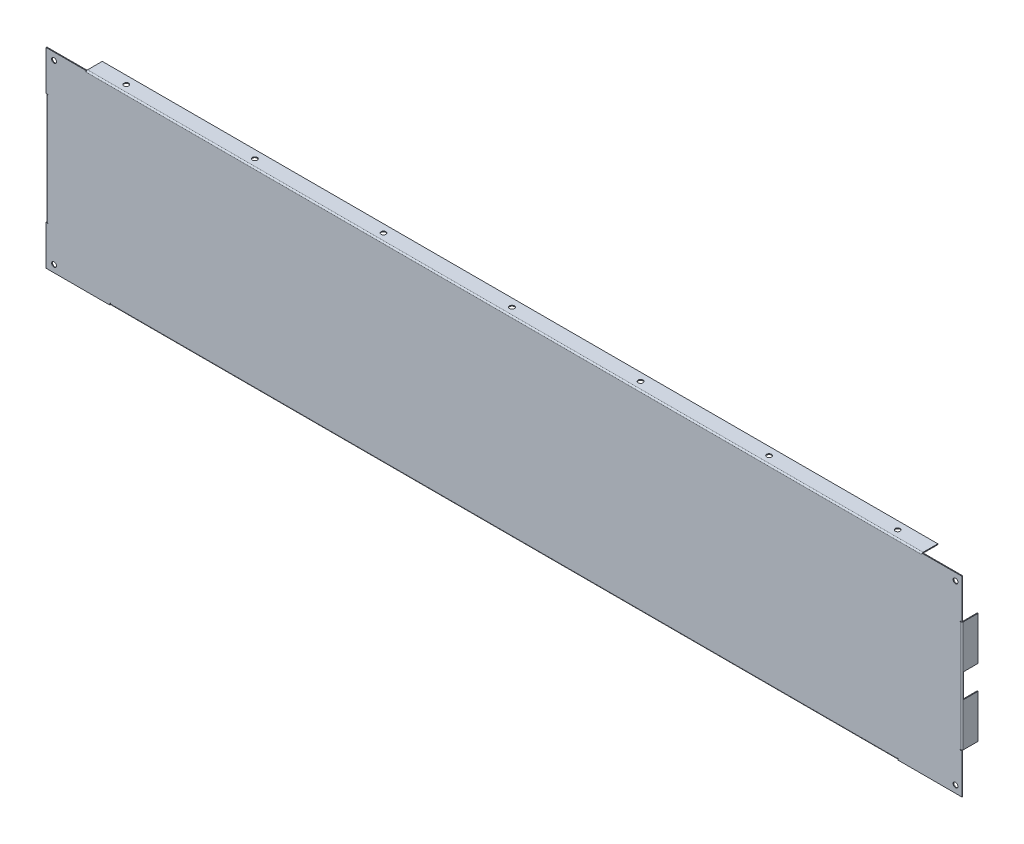
from build123d import *

# Parameters (mm, degrees)
SKETCH_1_W                        = 1140
SKETCH_1_H                        = 238
SM_BASE_FLANGE_1_DEPTH            = 1
SM_EDGE_FLANGE_1_STRIP_W          = 5.4732
SM_EDGE_FLANGE_1_STRIP_H          = 1
SM_EDGE_FLANGE_1_STRIP_CUT_DEPTH  = 138
SM_EDGE_FLANGE_1_RELIEF_W         = 5.9732
SM_EDGE_FLANGE_1_RELIEF_H         = 0.5
SM_EDGE_FLANGE_1_RELIEF_CUT_DEPTH = 1
SM_EDGE_FLANGE_1_DEPTH            = 138
SM_EDGE_FLANGE_1_FLAT_DEPTH       = 1
SM_EDGE_FLANGE_2_STRIP_W          = 5.4732
SM_EDGE_FLANGE_2_STRIP_H          = 1
SM_EDGE_FLANGE_2_STRIP_CUT_DEPTH  = 138
SM_EDGE_FLANGE_2_RELIEF_W         = 5.9732
SM_EDGE_FLANGE_2_RELIEF_H         = 0.5
SM_EDGE_FLANGE_2_RELIEF_CUT_DEPTH = 1
SM_EDGE_FLANGE_2_DEPTH            = 138
SM_EDGE_FLANGE_2_FLAT_DEPTH       = 1
SM_EDGE_FLANGE_3_STRIP_W          = 5.4732
SM_EDGE_FLANGE_3_STRIP_H          = 1
SM_EDGE_FLANGE_3_STRIP_CUT_DEPTH  = 980
SM_EDGE_FLANGE_3_RELIEF_W         = 5.9732
SM_EDGE_FLANGE_3_RELIEF_H         = 0.5
SM_EDGE_FLANGE_3_RELIEF_CUT_DEPTH = 1
SM_EDGE_FLANGE_3_DEPTH            = 980
SM_EDGE_FLANGE_4_STRIP_W          = 5.4732
SM_EDGE_FLANGE_4_STRIP_H          = 1
SM_EDGE_FLANGE_4_STRIP_CUT_DEPTH  = 1040
SM_EDGE_FLANGE_4_RELIEF_W         = 5.9732
SM_EDGE_FLANGE_4_RELIEF_H         = 0.5
SM_EDGE_FLANGE_4_RELIEF_CUT_DEPTH = 1
SM_EDGE_FLANGE_4_DEPTH            = 1040
SKETCH_15_R                       = 3
CUT_EXTRUDE_1_DEPTH               = 619.016181018
SKETCH_18_R                       = 3
CUT_EXTRUDE_2_DEPTH               = 583.599347751


# Sheet-metal steps are written as plain solids
with BuildPart() as part:
    # Sketch 1 → 基体-法兰1 (new body)
    with BuildSketch(Plane.XY):
        Rectangle(SKETCH_1_W, SKETCH_1_H)
    extrude(amount=-SM_BASE_FLANGE_1_DEPTH)

    # 边线-法兰1 strip (across the edge) → 边线-法兰1 strip cut (cut)
    with BuildSketch(Plane(origin=(570, 69, -1), x_dir=(-1, 0, 0), z_dir=(0, -1, 0))):
        with Locations((-1, -0.5)):
            Rectangle(SM_EDGE_FLANGE_1_STRIP_W, SM_EDGE_FLANGE_1_STRIP_H)
    extrude(amount=SM_EDGE_FLANGE_1_STRIP_CUT_DEPTH, mode=Mode.SUBTRACT)

    # 边线-法兰1 relief (on the sheet) → 边线-法兰1 relief cut (cut)
    with BuildSketch(Plane(origin=(568.2634, 69, -1), x_dir=(-1, 0, 0), z_dir=(0, 0, -1))):
        with Locations((-2.4866, 0.25)):
            Rectangle(SM_EDGE_FLANGE_1_RELIEF_W, SM_EDGE_FLANGE_1_RELIEF_H)
        with Locations((-2.4866, -138.25)):
            Rectangle(SM_EDGE_FLANGE_1_RELIEF_W, SM_EDGE_FLANGE_1_RELIEF_H)
    extrude(amount=-SM_EDGE_FLANGE_1_RELIEF_CUT_DEPTH, mode=Mode.SUBTRACT)

    # 边线-法兰1 bend section (across the edge) → 边线-法兰1 (add)
    with BuildSketch(Plane(origin=(570, 69, -1), x_dir=(-1, 0, 0), z_dir=(0, -1, 0))):
        with BuildLine():
            Line((0, 0.7366), (1, 0.7366))
            ThreePointArc((1, 0.7366), (1.215745145, 0.215745145), (1.7366, 0))
            Line((1.7366, 0), (1.7366, -1))
            ThreePointArc((1.7366, -1), (0.508638364, -0.491361636), (0, 0.7366))
        make_face()
    extrude(amount=SM_EDGE_FLANGE_1_DEPTH)

    # 边线-法兰1 profile (on flange) → 边线-法兰1 flat (add)
    with BuildSketch(Plane(origin=(570, 0, -1), x_dir=(0, -1, 0), z_dir=(1, 0, 0))):
        Polygon((-69, 0.7366), (69, 0.7366), (69, 19), (15, 19), (15, 1), (-15, 1), (-15, 19), (-69, 19), align=None)
    extrude(amount=-SM_EDGE_FLANGE_1_FLAT_DEPTH)

    # 边线-法兰2 strip (across the edge) → 边线-法兰2 strip cut (cut)
    with BuildSketch(Plane(origin=(-570, -69, -1), x_dir=(1, 0, 0), z_dir=(0, 1, 0))):
        with Locations((-1, -0.5)):
            Rectangle(SM_EDGE_FLANGE_2_STRIP_W, SM_EDGE_FLANGE_2_STRIP_H)
    extrude(amount=SM_EDGE_FLANGE_2_STRIP_CUT_DEPTH, mode=Mode.SUBTRACT)

    # 边线-法兰2 relief (on the sheet) → 边线-法兰2 relief cut (cut)
    with BuildSketch(Plane(origin=(-568.2634, -69, -1), x_dir=(1, 0, 0), z_dir=(0, 0, -1))):
        with Locations((-2.4866, 0.25)):
            Rectangle(SM_EDGE_FLANGE_2_RELIEF_W, SM_EDGE_FLANGE_2_RELIEF_H)
        with Locations((-2.4866, -138.25)):
            Rectangle(SM_EDGE_FLANGE_2_RELIEF_W, SM_EDGE_FLANGE_2_RELIEF_H)
    extrude(amount=-SM_EDGE_FLANGE_2_RELIEF_CUT_DEPTH, mode=Mode.SUBTRACT)

    # 边线-法兰2 bend section (across the edge) → 边线-法兰2 (add)
    with BuildSketch(Plane(origin=(-570, -69, -1), x_dir=(1, 0, 0), z_dir=(0, 1, 0))):
        with BuildLine():
            Line((0, 0.7366), (1, 0.7366))
            ThreePointArc((1, 0.7366), (1.215745145, 0.215745145), (1.7366, 0))
            Line((1.7366, 0), (1.7366, -1))
            ThreePointArc((1.7366, -1), (0.508638364, -0.491361636), (0, 0.7366))
        make_face()
    extrude(amount=SM_EDGE_FLANGE_2_DEPTH)

    # 边线-法兰2 profile (on flange) → 边线-法兰2 flat (add)
    with BuildSketch(Plane(origin=(-570, 0, -1), x_dir=(0, 1, 0), z_dir=(-1, 0, 0))):
        Polygon((-69, 0.7366), (69, 0.7366), (69, 19), (15, 19), (15, 1), (-15, 1), (-15, 19), (-69, 19), align=None)
    extrude(amount=-SM_EDGE_FLANGE_2_FLAT_DEPTH)

    # 边线-法兰3 strip (across the edge) → 边线-法兰3 strip cut (cut)
    with BuildSketch(Plane(origin=(490, -119, -1), x_dir=(0, 1, 0), z_dir=(-1, 0, 0))):
        with Locations((-1, -0.5)):
            Rectangle(SM_EDGE_FLANGE_3_STRIP_W, SM_EDGE_FLANGE_3_STRIP_H)
    extrude(amount=SM_EDGE_FLANGE_3_STRIP_CUT_DEPTH, mode=Mode.SUBTRACT)

    # 边线-法兰3 relief (on the sheet) → 边线-法兰3 relief cut (cut)
    with BuildSketch(Plane(origin=(490, -117.2634, -1), x_dir=(0, 1, 0), z_dir=(0, 0, -1))):
        with Locations((-2.4866, 0.25)):
            Rectangle(SM_EDGE_FLANGE_3_RELIEF_W, SM_EDGE_FLANGE_3_RELIEF_H)
        with Locations((-2.4866, -980.25)):
            Rectangle(SM_EDGE_FLANGE_3_RELIEF_W, SM_EDGE_FLANGE_3_RELIEF_H)
    extrude(amount=-SM_EDGE_FLANGE_3_RELIEF_CUT_DEPTH, mode=Mode.SUBTRACT)

    # 边线-法兰3 section (across the edge) → 边线-法兰3 (add)
    with BuildSketch(Plane(origin=(490, -119, -1), x_dir=(0, 1, 0), z_dir=(-1, 0, 0))):
        with BuildLine():
            Line((0, 0.7366), (0, 19))
            Line((0, 19), (1, 19))
            Line((1, 19), (1, 0.7366))
            ThreePointArc((1, 0.7366), (1.215745145, 0.215745145), (1.7366, 0))
            Line((1.7366, 0), (1.7366, -1))
            ThreePointArc((1.7366, -1), (0.508638364, -0.491361636), (0, 0.7366))
        make_face()
    extrude(amount=SM_EDGE_FLANGE_3_DEPTH)

    # 边线-法兰4 strip (across the edge) → 边线-法兰4 strip cut (cut)
    with BuildSketch(Plane(origin=(-520, 119, -1), x_dir=(0, -1, 0), z_dir=(1, 0, 0))):
        with Locations((-1, -0.5)):
            Rectangle(SM_EDGE_FLANGE_4_STRIP_W, SM_EDGE_FLANGE_4_STRIP_H)
    extrude(amount=SM_EDGE_FLANGE_4_STRIP_CUT_DEPTH, mode=Mode.SUBTRACT)

    # 边线-法兰4 relief (on the sheet) → 边线-法兰4 relief cut (cut)
    with BuildSketch(Plane(origin=(-520, 117.2634, -1), x_dir=(0, -1, 0), z_dir=(0, 0, -1))):
        with Locations((-2.4866, 0.25)):
            Rectangle(SM_EDGE_FLANGE_4_RELIEF_W, SM_EDGE_FLANGE_4_RELIEF_H)
        with Locations((-2.4866, -1040.25)):
            Rectangle(SM_EDGE_FLANGE_4_RELIEF_W, SM_EDGE_FLANGE_4_RELIEF_H)
    extrude(amount=-SM_EDGE_FLANGE_4_RELIEF_CUT_DEPTH, mode=Mode.SUBTRACT)

    # 边线-法兰4 section (across the edge) → 边线-法兰4 (add)
    with BuildSketch(Plane(origin=(-520, 119, -1), x_dir=(0, -1, 0), z_dir=(1, 0, 0))):
        with BuildLine():
            Line((0, 0.7366), (0, 19))
            Line((0, 19), (1, 19))
            Line((1, 19), (1, 0.7366))
            ThreePointArc((1, 0.7366), (1.215745145, 0.215745145), (1.7366, 0))
            Line((1.7366, 0), (1.7366, -1))
            ThreePointArc((1.7366, -1), (0.508638364, -0.491361636), (0, 0.7366))
        make_face()
    extrude(amount=SM_EDGE_FLANGE_4_DEPTH)

    # 草图15 → 切除-拉伸1 (cut, through all)
    with BuildSketch(Plane.XZ.offset(119)):
        with Locations(Location((-480, -10, 0), (0, 0, 270))):
            Circle(SKETCH_15_R)
        with Locations(Location((-320, -10, 0), (0, 0, 270))):
            Circle(SKETCH_15_R)
        with Locations(Location((-160, -10, 0), (0, 0, 270))):
            Circle(SKETCH_15_R)
        with Locations(Location((0, -10, 0), (0, 0, 270))):
            Circle(SKETCH_15_R)
        with Locations(Location((160, -10, 0), (0, 0, 270))):
            Circle(SKETCH_15_R)
        with Locations(Location((320, -10, 0), (0, 0, 270))):
            Circle(SKETCH_15_R)
        with Locations(Location((480, -10, 0), (0, 0, 270))):
            Circle(SKETCH_15_R)
    extrude(amount=-CUT_EXTRUDE_1_DEPTH, mode=Mode.SUBTRACT)

    # 草图18 → 切除-拉伸2 (cut, through all)
    with BuildSketch(Plane(origin=(0, 0, -1), x_dir=(-1, 0, 0), z_dir=(0, 0, -1))):
        with Locations((-562, -110)):
            Circle(SKETCH_18_R)
        with Locations((-562, 110)):
            Circle(SKETCH_18_R)
        with Locations((560, 110)):
            Circle(SKETCH_18_R)
        with Locations((560, -110)):
            Circle(SKETCH_18_R)
    extrude(amount=-CUT_EXTRUDE_2_DEPTH, mode=Mode.SUBTRACT)


solid = part.part
